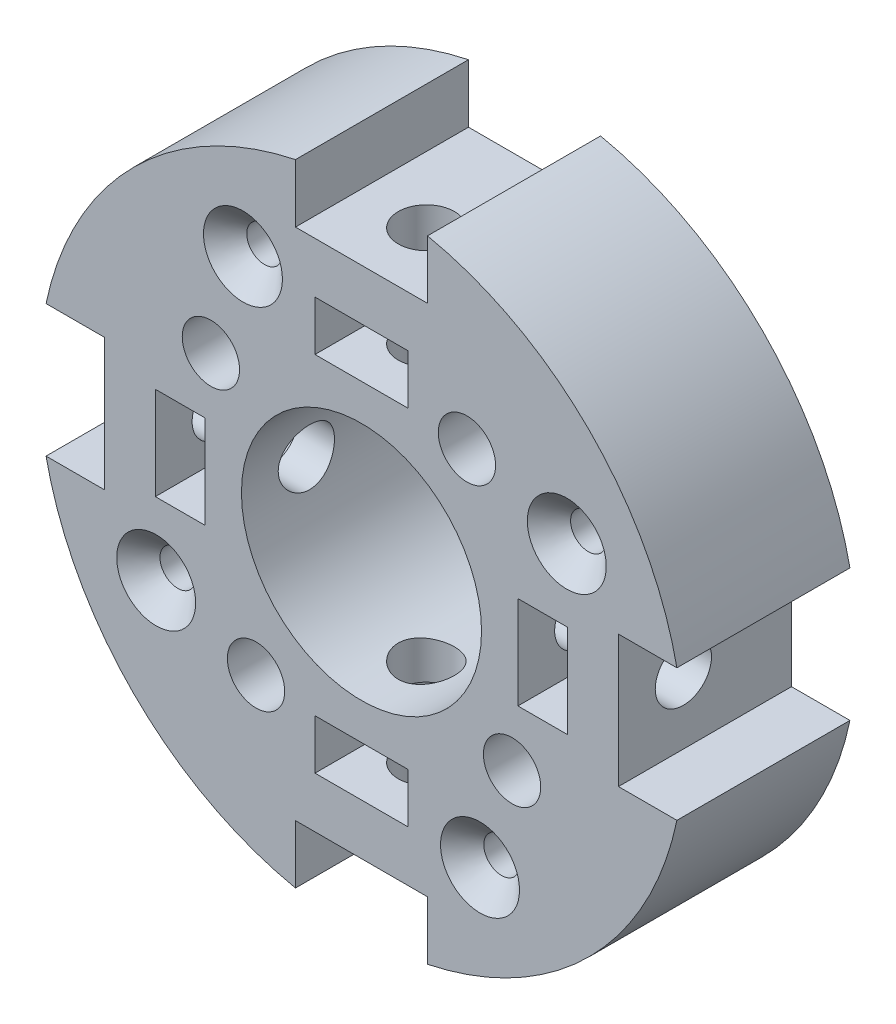
from build123d import *

# Parameters (mm, degrees)
ESQUISSE1_R                  = 1.65
ESQUISSE1_W                  = 4.6
ESQUISSE1_H                  = 8.6
ESQUISSE1_R_2                = 2.65
ESQUISSE1_W_2                = 8.6
ESQUISSE1_H_2                = 4.6
ESQUISSE1_R_3                = 11.1
BOSS_EXTRU_1_DEPTH           = 16
ENL_V_MAT_EXTRU_3_DEPTH      = 10
CHANFREIN1_SIZE              = 2
ESQUISSE6_R                  = 2.6
ENL_V_MAT_EXTRU_4_DEPTH      = 17
R_P_TITION_CIRCULAIRE1_COUNT = 4


with BuildPart() as part:
    # Esquisse1 → Boss.-Extru.1 (new body)
    with BuildSketch(Plane.XY):
        with BuildLine():
            Line((-6.105930323, 23.762922109), (-6.105930323, 29.167749568))
            ThreePointArc((-6.105930323, 29.167749568), (-21.071782079, 21.071782079), (-29.167749568, 6.105930323))
            Line((-29.167749568, 6.105930323), (-23.762922109, 6.105930323))
            Line((-23.762922109, 6.105930323), (-23.762922109, -6.105930323))
            Line((-23.762922109, -6.105930323), (-29.167749568, -6.105930323))
            ThreePointArc((-29.167749568, -6.105930323), (-21.071782079, -21.071782079), (-6.105930323, -29.167749568))
            Line((-6.105930323, -29.167749568), (-6.105930323, -23.762922109))
            Line((-6.105930323, -23.762922109), (6.105930323, -23.762922109))
            Line((6.105930323, -23.762922109), (6.105930323, -29.167749568))
            ThreePointArc((6.105930323, -29.167749568), (21.071782079, -21.071782079), (29.167749568, -6.105930323))
            Line((29.167749568, -6.105930323), (23.762922109, -6.105930323))
            Line((23.762922109, -6.105930323), (23.762922109, 6.105930323))
            Line((23.762922109, 6.105930323), (29.167749568, 6.105930323))
            ThreePointArc((29.167749568, 6.105930323), (21.071782079, 21.071782079), (6.105930323, 29.167749568))
            Line((6.105930323, 29.167749568), (6.105930323, 23.762922109))
            Line((6.105930323, 23.762922109), (-6.105930323, 23.762922109))
        make_face()
        with Locations((-18.983545507, -10.960155108)):
            Circle(ESQUISSE1_R, mode=Mode.SUBTRACT)
        with Locations((-16.762922109, 0)):
            Rectangle(ESQUISSE1_W, ESQUISSE1_H, mode=Mode.SUBTRACT)
        with Locations((-9.750799418, -13.925584753)):
            Circle(ESQUISSE1_R_2, mode=Mode.SUBTRACT)
        with Locations((0, -16.762922109)):
            Rectangle(ESQUISSE1_W_2, ESQUISSE1_H_2, mode=Mode.SUBTRACT)
        with Locations((10.960155108, -18.983545507)):
            Circle(ESQUISSE1_R, mode=Mode.SUBTRACT)
        with Locations((13.925584753, -9.750799418)):
            Circle(ESQUISSE1_R_2, mode=Mode.SUBTRACT)
        with Locations((-13.925584753, 9.750799418)):
            Circle(ESQUISSE1_R_2, mode=Mode.SUBTRACT)
        with Locations((-10.960155108, 18.983545507)):
            Circle(ESQUISSE1_R, mode=Mode.SUBTRACT)
        Circle(ESQUISSE1_R_3, mode=Mode.SUBTRACT)
        with Locations((9.750799418, 13.925584753)):
            Circle(ESQUISSE1_R_2, mode=Mode.SUBTRACT)
        with Locations((16.762922109, 0)):
            Rectangle(ESQUISSE1_W, ESQUISSE1_H, mode=Mode.SUBTRACT)
        with Locations((18.983545507, 10.960155108)):
            Circle(ESQUISSE1_R, mode=Mode.SUBTRACT)
        with Locations((0, 16.762922109)):
            Rectangle(ESQUISSE1_W_2, ESQUISSE1_H_2, mode=Mode.SUBTRACT)
    extrude(amount=BOSS_EXTRU_1_DEPTH)

    # Esquisse5 → Enlèv. mat.-Extru.3 (cut)
    with BuildSketch(Plane(origin=(0, 0, 0), x_dir=(-1, 0, 0), z_dir=(0, 0, -1))):
        Polygon((9.191312546, 9.750799418), (11.558448649, 5.650799418), (16.292720857, 5.650799418), (18.65985696, 9.750799418), (16.292720857, 13.850799418), (11.558448649, 13.850799418), align=None)
        Polygon((-9.750799418, 9.191312546), (-5.650799418, 11.558448649), (-5.650799418, 16.292720857), (-9.750799418, 18.65985696), (-13.850799418, 16.292720857), (-13.850799418, 11.558448649), align=None)
        Polygon((9.750799418, -9.191312546), (5.650799418, -11.558448649), (5.650799418, -16.292720857), (9.750799418, -18.65985696), (13.850799418, -16.292720857), (13.850799418, -11.558448649), align=None)
        Polygon((-9.191312546, -9.750799418), (-11.558448649, -5.650799418), (-16.292720857, -5.650799418), (-18.65985696, -9.750799418), (-16.292720857, -13.850799418), (-11.558448649, -13.850799418), align=None)
    extrude(amount=-ENL_V_MAT_EXTRU_3_DEPTH, mode=Mode.SUBTRACT)

    # Chanfrein1
    chanfrein1_edges = [part.edges().sort_by_distance(p)[0] for p in [
        (-20.633545507, -10.960155108, 16),
        (9.310155108, -18.983545507, 16),
        (17.333545507, 10.960155108, 16),
        (-12.610155108, 18.983545507, 16),
    ]]
    chamfer(chanfrein1_edges, length=CHANFREIN1_SIZE)

    # Esquisse6 → Enlèv. mat.-Extru.4 (cut)
    with BuildSketch(Plane.ZY.offset(23.762922109)):
        with Locations((10, 0)):
            Circle(ESQUISSE6_R)
    enl_v_mat_extru_4 = extrude(amount=-ENL_V_MAT_EXTRU_4_DEPTH, mode=Mode.SUBTRACT)

    # Répétition circulaire1: Enlèv. mat.-Extru.4 ×4 about axis
    r_p_tition_circulaire1_axis = Axis((0, 0, 0), (0, 0, 1))
    for i in range(1, R_P_TITION_CIRCULAIRE1_COUNT):
        add(enl_v_mat_extru_4.rotate(r_p_tition_circulaire1_axis, i * 360 / R_P_TITION_CIRCULAIRE1_COUNT), mode=Mode.SUBTRACT)


solid = part.part
